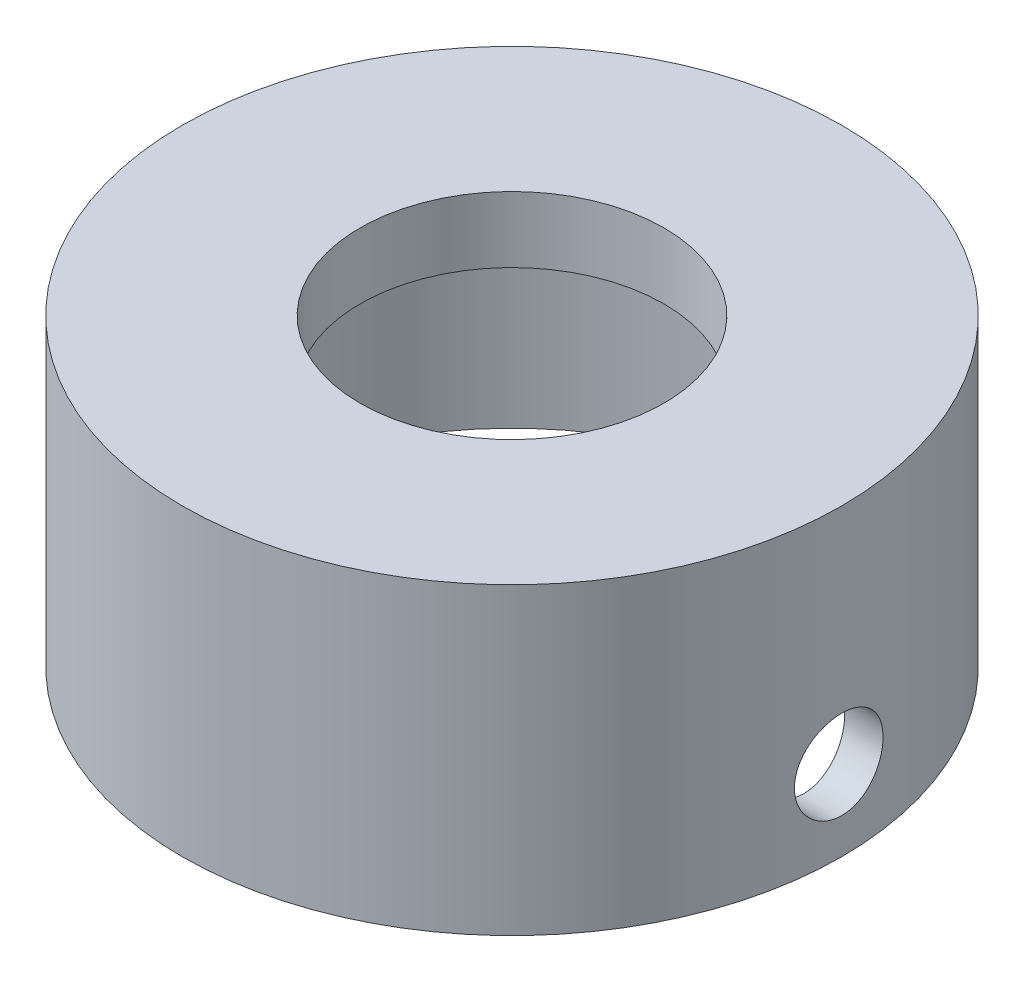
from build123d import *

# Parameters (mm, degrees)
SKETCH1_R               = 20.66925
BOSS_EXTRUDE1_DEPTH     = 19.05
SKETCH2_R               = 18.288
CUT_EXTRUDE1_DEPTH      = 13.3985
SKETCH3_R               = 9.525
CUT_EXTRUDE2_DEPTH      = 35.890375337
SKETCH4_R               = 15.875
CUT_EXTRUDE3_DEPTH      = 1.524
CUT_EXTRUDE4_DEPTH      = 35.890375337
CUT_EXTRUDE4_DEPTH_BACK = 35.890375337
SKETCH5_R               = 2.778125


with BuildPart() as part:
    # Sketch1 → Boss-Extrude1 (new body)
    with BuildSketch(Plane(origin=(0, 0, 0), x_dir=(1, 0, 0), z_dir=(0, 1, 0))):
        Circle(SKETCH1_R)
    extrude(amount=-BOSS_EXTRUDE1_DEPTH)

    # Sketch2 → Cut-Extrude1 (cut)
    with BuildSketch(Plane.XZ.offset(19.05)):
        Circle(SKETCH2_R)
    extrude(amount=-CUT_EXTRUDE1_DEPTH, mode=Mode.SUBTRACT)

    # Sketch3 → Cut-Extrude2 (cut, through all)
    with BuildSketch(Plane(origin=(0, 0, 0), x_dir=(1, 0, 0), z_dir=(0, 1, 0))):
        Circle(SKETCH3_R)
    extrude(amount=-CUT_EXTRUDE2_DEPTH, mode=Mode.SUBTRACT)

    # Sketch4 → Cut-Extrude3 (cut)
    with BuildSketch(Plane.XZ.offset(5.6515)):
        Circle(SKETCH4_R)
    extrude(amount=-CUT_EXTRUDE3_DEPTH, mode=Mode.SUBTRACT)

    # Sketch5 → Cut-Extrude4 (cut, two sides: drawn at the far end of the back side and taken through both)
    with BuildSketch(Plane(origin=(0, 0, 0), x_dir=(0, 0, -1), z_dir=(1, 0, 0)).offset(-CUT_EXTRUDE4_DEPTH_BACK)):
        with Locations((0, -14.0335)):
            Circle(SKETCH5_R)
    extrude(amount=CUT_EXTRUDE4_DEPTH + CUT_EXTRUDE4_DEPTH_BACK, mode=Mode.SUBTRACT)


solid = part.part
